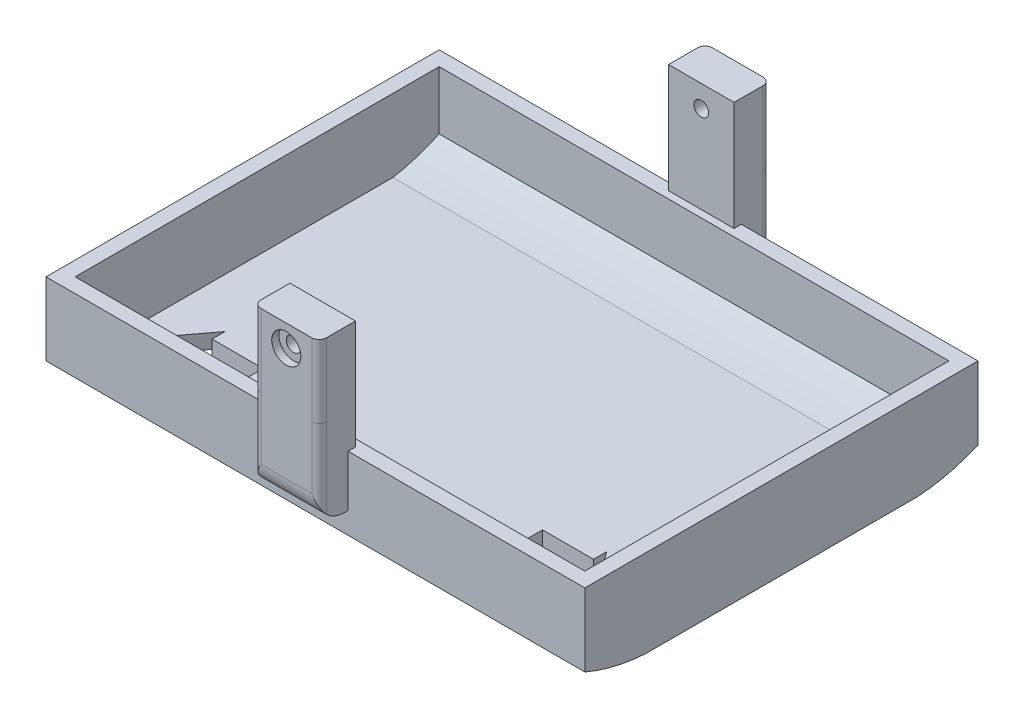
from build123d import *

# Parameters (mm, degrees)
CROQUIS1_W              = 74
CROQUIS1_H              = 54
SALIENTE_EXTRUIR1_DEPTH = 6
CROQUIS3_W              = 9
CROQUIS3_H              = 5
SALIENTE_EXTRUIR2_DEPTH = 10
REDONDEO1_R             = 1
CORTAR_EXTRUIR1_DEPTH   = 100
CORTAR_EXTRUIR2_DEPTH   = 100
CORTAR_EXTRUIR3_DEPTH   = 70
CROQUIS8_W              = 8
CROQUIS8_H              = 6
CORTAR_EXTRUIR4_DEPTH   = 6
REDONDEO2_R             = 1
CROQUIS11_W             = 9
CROQUIS11_H             = 5
SALIENTE_EXTRUIR3_DEPTH = 5
REDONDEO3_R             = 1
CROQUIS17_R             = 1
CORTAR_EXTRUIR10_DEPTH  = 100
CROQUIS18_R             = 2
CORTAR_EXTRUIR11_DEPTH  = 1
CORTAR_EXTRUIR12_START  = -1
CROQUIS19_R             = 2
CORTAR_EXTRUIR12_DEPTH  = 1
CROQUIS12_R             = 1
CORTAR_EXTRUIR7_DEPTH   = 100
CROQUIS15_R             = 2
CORTAR_EXTRUIR8_DEPTH   = 1
CORTAR_EXTRUIR9_START   = -1
CROQUIS16_R             = 2
CORTAR_EXTRUIR9_DEPTH   = 1


with BuildPart() as part:
    # Croquis1 → Saliente-Extruir1 (new, symmetric)
    with BuildSketch(Plane(origin=(0, 0, 0), x_dir=(1, 0, 0), z_dir=(0, 1, 0))):
        Rectangle(CROQUIS1_W, CROQUIS1_H)
    extrude(amount=SALIENTE_EXTRUIR1_DEPTH, both=True)

    # Croquis3 → Saliente-Extruir2 (add, symmetric)
    with BuildSketch(Plane(origin=(0, 6, 0), x_dir=(1, 0, 0), z_dir=(0, 1, 0))):
        with Locations((0, -28.5)):
            Rectangle(CROQUIS3_W, CROQUIS3_H)
        with Locations((0, 28.5)):
            Rectangle(CROQUIS3_W, CROQUIS3_H)
    extrude(amount=SALIENTE_EXTRUIR2_DEPTH, both=True)

    # Redondeo1
    redondeo1_edges = [part.edges().sort_by_distance(p)[0] for p in [
        (4.5, 6, 31),
        (-4.5, 6, 31),
        (4.5, 6, -31),
        (-4.5, 6, -31),
    ]]
    fillet(redondeo1_edges, radius=REDONDEO1_R)

    # Croquis5 → Cortar-Extruir1 (cut)
    with BuildSketch(Plane(origin=(37, 0, 0), x_dir=(0, 0, -1), z_dir=(1, 0, 0))):
        with BuildLine():
            Line((-31, -1.820778385), (-31, -6))
            Line((-31, -6), (-18.642754783, -6))
            ThreePointArc((-18.642754783, -6), (-25.098766863, -4.730582529), (-31, -1.820778385))
        make_face()
        with BuildLine():
            Line((31, -1.820778385), (31, -6))
            Line((31, -6), (18.642754783, -6))
            ThreePointArc((18.642754783, -6), (25.098766863, -4.730582529), (31, -1.820778385))
        make_face()
    extrude(amount=-CORTAR_EXTRUIR1_DEPTH, mode=Mode.SUBTRACT)

    # Croquis6 → Cortar-Extruir2 (cut)
    with BuildSketch(Plane.ZY.offset(37)):
        with BuildLine():
            Line((-27, -1), (-27, -4))
            Line((-27, -4), (-31, -4))
            Line((-31, -4), (-33.432664366, -4))
            Line((-33.432664366, -4), (-33.432664366, 2.46409105))
            Line((-33.432664366, 2.46409105), (-31, 2.46409105))
            ThreePointArc((-31, 2.46409105), (-29.791283854, -0.181653154), (-27, -1))
        make_face()
        with BuildLine():
            Line((27, -1), (27, -4))
            Line((27, -4), (31, -4))
            Line((31, -4), (33.432664366, -4))
            Line((33.432664366, -4), (33.432664366, 2.46409105))
            Line((33.432664366, 2.46409105), (31, 2.46409105))
            ThreePointArc((31, 2.46409105), (29.791283854, -0.181653154), (27, -1))
        make_face()
    extrude(amount=-CORTAR_EXTRUIR2_DEPTH, mode=Mode.SUBTRACT)

    # Croquis7 → Cortar-Extruir3 (cut)
    with BuildSketch(Plane.ZY.offset(35)):
        with BuildLine():
            Line((-25, 6), (25, 6))
            Line((25, 6), (25, -2))
            ThreePointArc((25, -2), (21.888320303, -3.212786251), (18.642754783, -4))
            Line((18.642754783, -4), (-18.642754783, -4))
            ThreePointArc((-18.642754783, -4), (-21.888320303, -3.212786251), (-25, -2))
            Line((-25, -2), (-25, 6))
        make_face()
    extrude(amount=-CORTAR_EXTRUIR3_DEPTH, mode=Mode.SUBTRACT)

    # Croquis8 → Cortar-Extruir4 (cut)
    with BuildSketch(Plane.XZ.offset(6)):
        Polygon((-31.805445069, 16), (-28.194554931, 11.20818694), (-28.194554931, 13), (-21.194554931, 13), (-21.194554931, 19), (-28.194554931, 19), (-28.194554931, 20.79181306), align=None)
        Polygon((24.194554931, 13), (17.194554931, 13), (17.194554931, 19), (24.194554931, 19), (24.194554931, 20.79181306), (27.805445069, 16), (24.194554931, 11.20818694), align=None)
        with Locations((-2, 23)):
            Rectangle(CROQUIS8_W, CROQUIS8_H)
    extrude(amount=-CORTAR_EXTRUIR4_DEPTH, mode=Mode.SUBTRACT)

    # Redondeo2
    redondeo2_edges = [part.edges().sort_by_distance(p)[0] for p in [
        (-6, -4.802427791, 20),
        (2, -4.802427791, 20),
        (2, -2.203209257, 26),
        (-6, -2.203209257, 26),
    ]]
    fillet(redondeo2_edges, radius=REDONDEO2_R - 0.0001)  # a hair under: the kernel refuses the full size

    # Croquis11 → Saliente-Extruir3 (add, symmetric)
    with BuildSketch(Plane(origin=(0, 16, 0), x_dir=(1, 0, 0), z_dir=(0, 1, 0))):
        with Locations((0, -28.5)):
            Rectangle(CROQUIS11_W, CROQUIS11_H)
        with Locations((0, 28.5)):
            Rectangle(CROQUIS11_W, CROQUIS11_H)
    extrude(amount=SALIENTE_EXTRUIR3_DEPTH, both=True)

    # Redondeo3
    redondeo3_edges = [part.edges().sort_by_distance(p)[0] for p in [
        (-4.5, 16, -31),
        (4.5, 16, -31),
        (-4.5, 16, 31),
        (4.5, 16, 31),
    ]]
    fillet(redondeo3_edges, radius=REDONDEO3_R)

    # Croquis17 → Cortar-Extruir10 (cut)
    with BuildSketch(Plane.XY.offset(31)):
        with Locations((0, 18)):
            Circle(CROQUIS17_R)
    extrude(amount=-CORTAR_EXTRUIR10_DEPTH, mode=Mode.SUBTRACT)

    # Croquis18 → Cortar-Extruir11 (cut)
    with BuildSketch(Plane.XY.offset(31)):
        with Locations((0, 18)):
            Circle(CROQUIS18_R)
    extrude(amount=-CORTAR_EXTRUIR11_DEPTH, mode=Mode.SUBTRACT)

    # Croquis19 → Cortar-Extruir12 (cut)
    with BuildSketch(Plane(origin=(0, 0, -31), x_dir=(-1, 0, 0), z_dir=(0, 0, -1)).offset(CORTAR_EXTRUIR12_START)):
        with Locations(Location((0, 18, 0), (0, 0, 180))):
            Circle(CROQUIS19_R)
    extrude(amount=CORTAR_EXTRUIR12_DEPTH, mode=Mode.SUBTRACT)

    # Croquis12 → Cortar-Extruir7 (cut)
    with BuildSketch(Plane.XY.offset(31)):
        with Locations(Location((0, 18, 0), (0, 0, 180))):
            Circle(CROQUIS12_R)
    extrude(amount=-CORTAR_EXTRUIR7_DEPTH, mode=Mode.SUBTRACT)

    # Croquis15 → Cortar-Extruir8 (cut)
    with BuildSketch(Plane.XY.offset(31)):
        with Locations((0, 18)):
            Circle(CROQUIS15_R)
    extrude(amount=-CORTAR_EXTRUIR8_DEPTH, mode=Mode.SUBTRACT)

    # Croquis16 → Cortar-Extruir9 (cut)
    with BuildSketch(Plane(origin=(0, 0, -31), x_dir=(-1, 0, 0), z_dir=(0, 0, -1)).offset(CORTAR_EXTRUIR9_START)):
        with Locations(Location((0, 18, 0), (0, 0, 180))):
            Circle(CROQUIS16_R)
    extrude(amount=CORTAR_EXTRUIR9_DEPTH, mode=Mode.SUBTRACT)


solid = part.part
